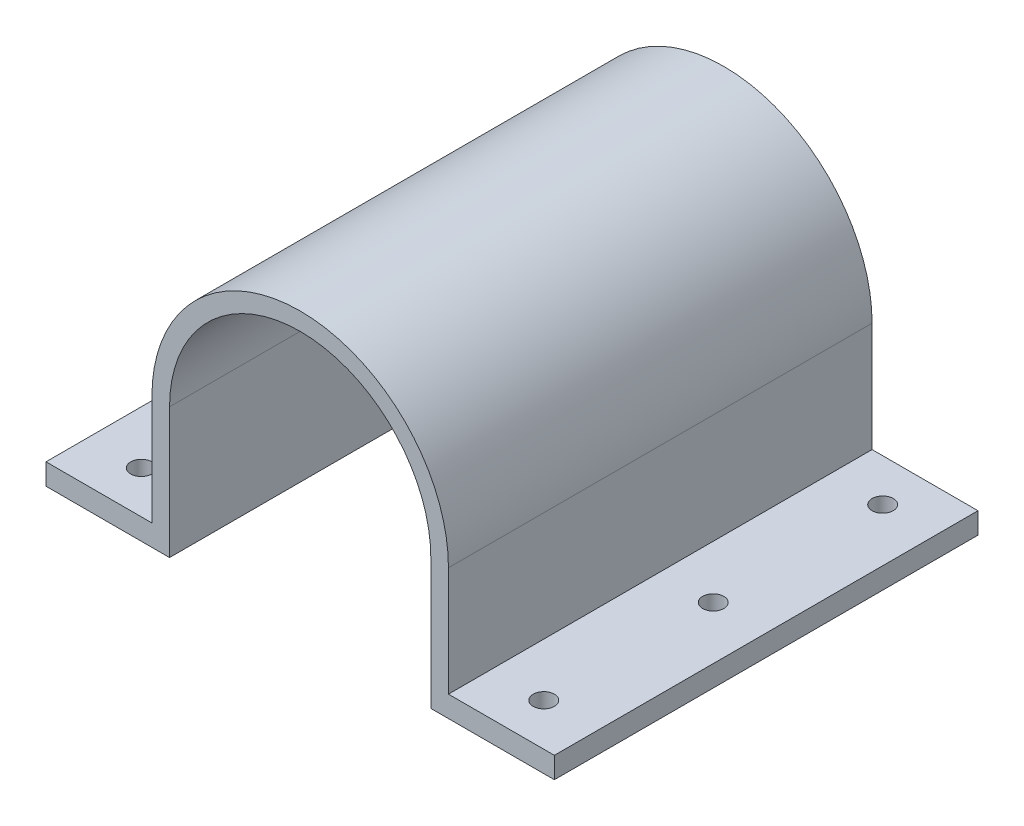
from build123d import *

# Parameters (mm, degrees)
SKETCH1_R           = 1.65
SKETCH1_R_2         = 6.15
BOSS_EXTRUDE1_DEPTH = 60
CUT_EXTRUDE1_DEPTH  = 57
SKETCH3_R           = 1.5
CUT_EXTRUDE2_DEPTH  = 79.919262541


with BuildPart() as part:
    # Sketch1 → Boss-Extrude1 (new body)
    with BuildSketch(Plane.XY):
        with BuildLine():
            Line((-21, 0), (-21, -15.5))
            Line((-21, -15.5), (-36, -15.5))
            Line((-36, -15.5), (-36, -18.5))
            Line((-36, -18.5), (36, -18.5))
            Line((36, -18.5), (36, -15.5))
            Line((36, -15.5), (21, -15.5))
            Line((21, -15.5), (21, 0))
            ThreePointArc((21, 0), (0, 21), (-21, 0))
        make_face()
        with Locations((-15.5, 0)):
            Circle(SKETCH1_R, mode=Mode.SUBTRACT)
        with Locations((-7.75, 13.423393759)):
            Circle(SKETCH1_R, mode=Mode.SUBTRACT)
        with Locations((7.75, 13.423393759)):
            Circle(SKETCH1_R, mode=Mode.SUBTRACT)
        with Locations((15.5, 0)):
            Circle(SKETCH1_R, mode=Mode.SUBTRACT)
        with Locations((7.75, -13.423393759)):
            Circle(SKETCH1_R, mode=Mode.SUBTRACT)
        with Locations((-7.75, -13.423393759)):
            Circle(SKETCH1_R, mode=Mode.SUBTRACT)
        with Locations((0, 7)):
            Circle(SKETCH1_R_2, mode=Mode.SUBTRACT)
    extrude(amount=BOSS_EXTRUDE1_DEPTH)

    # Sketch2 → Cut-Extrude1 (cut)
    with BuildSketch(Plane.XY.offset(60)):
        with BuildLine():
            Line((-18.5, 0), (-18.5, -18.5))
            Line((-18.5, -18.5), (18.5, -18.5))
            Line((18.5, -18.5), (18.5, 0))
            ThreePointArc((18.5, 0), (0, 18.5), (-18.5, 0))
        make_face()
    extrude(amount=-CUT_EXTRUDE1_DEPTH, mode=Mode.SUBTRACT)

    # Sketch3 → Cut-Extrude2 (cut, through all)
    with BuildSketch(Plane(origin=(0, -15.5, 0), x_dir=(1, 0, 0), z_dir=(0, 1, 0))):
        with Locations((-28.5, -30)):
            Circle(SKETCH3_R)
        with Locations((-28.5, -6)):
            Circle(SKETCH3_R)
        with Locations((-28.5, -54)):
            Circle(SKETCH3_R)
        with Locations((28.5, -54)):
            Circle(SKETCH3_R)
        with Locations((28.5, -6)):
            Circle(SKETCH3_R)
        with Locations((28.5, -30)):
            Circle(SKETCH3_R)
    extrude(amount=-CUT_EXTRUDE2_DEPTH, mode=Mode.SUBTRACT)


solid = part.part
